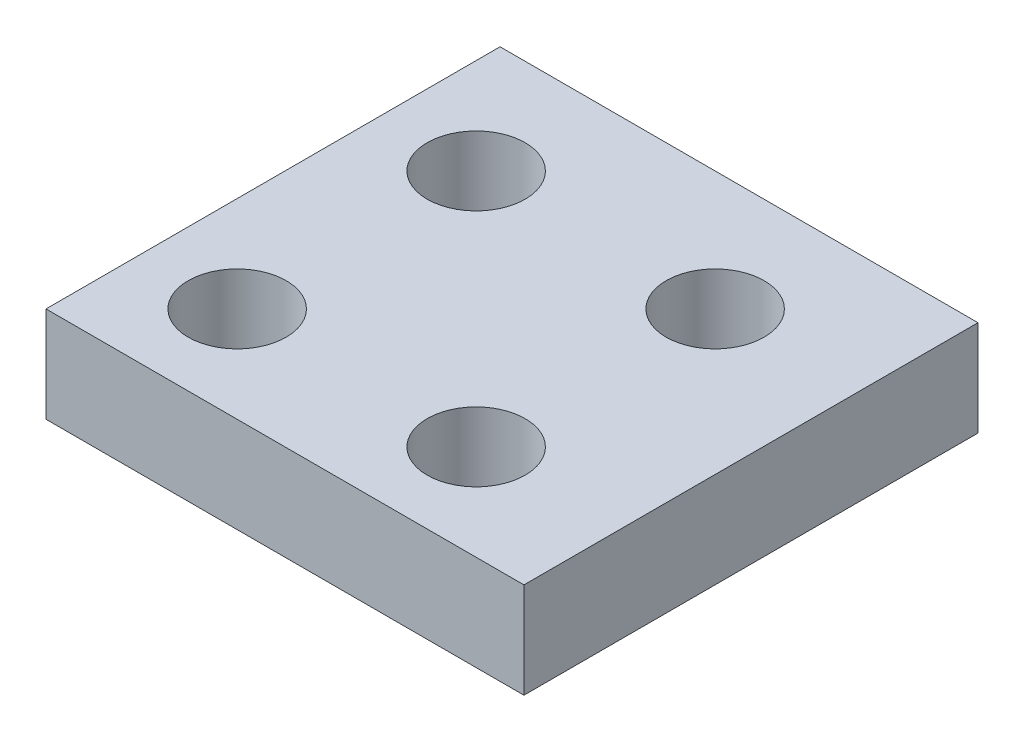
from build123d import *

# Parameters (mm, degrees)
SKETCH2_W               = 350
SKETCH2_H               = 350
BOSS_EXTRUDE2_DEPTH     = 10
ADVANCEDHOLE1_OUTLINE_R = 5.125
ADVANCEDHOLE1_DEPTH     = 10
CUT_EXTRUDE4_DEPTH      = 50
CUT_EXTRUDE5_DEPTH      = 50


# Read off the part's stored shape, not the designer's step: AdvancedHole1
with BuildPart() as part:
    # Sketch2 → Boss-Extrude2 (new body)
    with BuildSketch(Plane(origin=(0, 0, 0), x_dir=(1, 0, 0), z_dir=(0, 1, 0))):
        with Locations((175, 175)):
            Rectangle(SKETCH2_W, SKETCH2_H)
    extrude(amount=BOSS_EXTRUDE2_DEPTH)

    # AdvancedHole1 outline → AdvancedHole1 (cut)
    with BuildSketch(Plane(origin=(0, 0, 0), x_dir=(1, 0, 0), z_dir=(0, 1, 0))):
        with Locations((10, 310)):
            Circle(ADVANCEDHOLE1_OUTLINE_R)
        with Locations((10, 335)):
            Circle(ADVANCEDHOLE1_OUTLINE_R)
        with Locations((35, 335)):
            Circle(ADVANCEDHOLE1_OUTLINE_R)
        with Locations((35, 310)):
            Circle(ADVANCEDHOLE1_OUTLINE_R)
        with Locations((60, 335)):
            Circle(ADVANCEDHOLE1_OUTLINE_R)
        with Locations((85, 335)):
            Circle(ADVANCEDHOLE1_OUTLINE_R)
        with Locations((60, 310)):
            Circle(ADVANCEDHOLE1_OUTLINE_R)
        with Locations((85, 310)):
            Circle(ADVANCEDHOLE1_OUTLINE_R)
        with Locations((10, 285)):
            Circle(ADVANCEDHOLE1_OUTLINE_R)
        with Locations((35, 285)):
            Circle(ADVANCEDHOLE1_OUTLINE_R)
        with Locations((60, 285)):
            Circle(ADVANCEDHOLE1_OUTLINE_R)
        with Locations((85, 285)):
            Circle(ADVANCEDHOLE1_OUTLINE_R)
        with Locations((10, 260)):
            Circle(ADVANCEDHOLE1_OUTLINE_R)
        with Locations((35, 260)):
            Circle(ADVANCEDHOLE1_OUTLINE_R)
        with Locations((60, 260)):
            Circle(ADVANCEDHOLE1_OUTLINE_R)
        with Locations((85, 260)):
            Circle(ADVANCEDHOLE1_OUTLINE_R)
        with Locations((110, 285)):
            Circle(ADVANCEDHOLE1_OUTLINE_R)
        with Locations((110, 310)):
            Circle(ADVANCEDHOLE1_OUTLINE_R)
        with Locations((110, 335)):
            Circle(ADVANCEDHOLE1_OUTLINE_R)
        with Locations((135, 285)):
            Circle(ADVANCEDHOLE1_OUTLINE_R)
        with Locations((135, 310)):
            Circle(ADVANCEDHOLE1_OUTLINE_R)
        with Locations((135, 335)):
            Circle(ADVANCEDHOLE1_OUTLINE_R)
        with Locations((160, 335)):
            Circle(ADVANCEDHOLE1_OUTLINE_R)
        with Locations((160, 310)):
            Circle(ADVANCEDHOLE1_OUTLINE_R)
        with Locations((110, 260)):
            Circle(ADVANCEDHOLE1_OUTLINE_R)
        with Locations((135, 260)):
            Circle(ADVANCEDHOLE1_OUTLINE_R)
        with Locations((160, 285)):
            Circle(ADVANCEDHOLE1_OUTLINE_R)
        with Locations((160, 260)):
            Circle(ADVANCEDHOLE1_OUTLINE_R)
        with Locations((185, 335)):
            Circle(ADVANCEDHOLE1_OUTLINE_R)
        with Locations((185, 310)):
            Circle(ADVANCEDHOLE1_OUTLINE_R)
        with Locations((185, 285)):
            Circle(ADVANCEDHOLE1_OUTLINE_R)
        with Locations((185, 260)):
            Circle(ADVANCEDHOLE1_OUTLINE_R)
        with Locations((210, 310)):
            Circle(ADVANCEDHOLE1_OUTLINE_R)
        with Locations((210, 335)):
            Circle(ADVANCEDHOLE1_OUTLINE_R)
        with Locations((235, 310)):
            Circle(ADVANCEDHOLE1_OUTLINE_R)
        with Locations((235, 335)):
            Circle(ADVANCEDHOLE1_OUTLINE_R)
        with Locations((260, 310)):
            Circle(ADVANCEDHOLE1_OUTLINE_R)
        with Locations((285, 310)):
            Circle(ADVANCEDHOLE1_OUTLINE_R)
        with Locations((260, 335)):
            Circle(ADVANCEDHOLE1_OUTLINE_R)
        with Locations((285, 335)):
            Circle(ADVANCEDHOLE1_OUTLINE_R)
        with Locations((310, 335)):
            Circle(ADVANCEDHOLE1_OUTLINE_R)
        with Locations((335, 335)):
            Circle(ADVANCEDHOLE1_OUTLINE_R)
        with Locations((310, 310)):
            Circle(ADVANCEDHOLE1_OUTLINE_R)
        with Locations((335, 310)):
            Circle(ADVANCEDHOLE1_OUTLINE_R)
        with Locations((210, 285)):
            Circle(ADVANCEDHOLE1_OUTLINE_R)
        with Locations((235, 285)):
            Circle(ADVANCEDHOLE1_OUTLINE_R)
        with Locations((260, 285)):
            Circle(ADVANCEDHOLE1_OUTLINE_R)
        with Locations((285, 285)):
            Circle(ADVANCEDHOLE1_OUTLINE_R)
        with Locations((310, 285)):
            Circle(ADVANCEDHOLE1_OUTLINE_R)
        with Locations((335, 285)):
            Circle(ADVANCEDHOLE1_OUTLINE_R)
        with Locations((210, 260)):
            Circle(ADVANCEDHOLE1_OUTLINE_R)
        with Locations((235, 260)):
            Circle(ADVANCEDHOLE1_OUTLINE_R)
        with Locations((260, 260)):
            Circle(ADVANCEDHOLE1_OUTLINE_R)
        with Locations((285, 260)):
            Circle(ADVANCEDHOLE1_OUTLINE_R)
        with Locations((310, 260)):
            Circle(ADVANCEDHOLE1_OUTLINE_R)
        with Locations((335, 260)):
            Circle(ADVANCEDHOLE1_OUTLINE_R)
        with Locations((10, 235)):
            Circle(ADVANCEDHOLE1_OUTLINE_R)
        with Locations((35, 235)):
            Circle(ADVANCEDHOLE1_OUTLINE_R)
        with Locations((60, 235)):
            Circle(ADVANCEDHOLE1_OUTLINE_R)
        with Locations((85, 235)):
            Circle(ADVANCEDHOLE1_OUTLINE_R)
        with Locations((110, 235)):
            Circle(ADVANCEDHOLE1_OUTLINE_R)
        with Locations((135, 235)):
            Circle(ADVANCEDHOLE1_OUTLINE_R)
        with Locations((160, 235)):
            Circle(ADVANCEDHOLE1_OUTLINE_R)
        with Locations((185, 235)):
            Circle(ADVANCEDHOLE1_OUTLINE_R)
        with Locations((210, 235)):
            Circle(ADVANCEDHOLE1_OUTLINE_R)
        with Locations((235, 235)):
            Circle(ADVANCEDHOLE1_OUTLINE_R)
        with Locations((260, 235)):
            Circle(ADVANCEDHOLE1_OUTLINE_R)
        with Locations((285, 235)):
            Circle(ADVANCEDHOLE1_OUTLINE_R)
        with Locations((310, 235)):
            Circle(ADVANCEDHOLE1_OUTLINE_R)
        with Locations((335, 235)):
            Circle(ADVANCEDHOLE1_OUTLINE_R)
        with Locations((10, 210)):
            Circle(ADVANCEDHOLE1_OUTLINE_R)
        with Locations((35, 210)):
            Circle(ADVANCEDHOLE1_OUTLINE_R)
        with Locations((60, 210)):
            Circle(ADVANCEDHOLE1_OUTLINE_R)
        with Locations((85, 210)):
            Circle(ADVANCEDHOLE1_OUTLINE_R)
        with Locations((110, 210)):
            Circle(ADVANCEDHOLE1_OUTLINE_R)
        with Locations((135, 210)):
            Circle(ADVANCEDHOLE1_OUTLINE_R)
        with Locations((160, 210)):
            Circle(ADVANCEDHOLE1_OUTLINE_R)
        with Locations((185, 210)):
            Circle(ADVANCEDHOLE1_OUTLINE_R)
        with Locations((210, 210)):
            Circle(ADVANCEDHOLE1_OUTLINE_R)
        with Locations((235, 210)):
            Circle(ADVANCEDHOLE1_OUTLINE_R)
        with Locations((260, 210)):
            Circle(ADVANCEDHOLE1_OUTLINE_R)
        with Locations((285, 210)):
            Circle(ADVANCEDHOLE1_OUTLINE_R)
        with Locations((310, 210)):
            Circle(ADVANCEDHOLE1_OUTLINE_R)
        with Locations((335, 210)):
            Circle(ADVANCEDHOLE1_OUTLINE_R)
        with Locations((10, 185)):
            Circle(ADVANCEDHOLE1_OUTLINE_R)
        with Locations((35, 185)):
            Circle(ADVANCEDHOLE1_OUTLINE_R)
        with Locations((60, 185)):
            Circle(ADVANCEDHOLE1_OUTLINE_R)
        with Locations((85, 185)):
            Circle(ADVANCEDHOLE1_OUTLINE_R)
        with Locations((110, 185)):
            Circle(ADVANCEDHOLE1_OUTLINE_R)
        with Locations((135, 185)):
            Circle(ADVANCEDHOLE1_OUTLINE_R)
        with Locations((160, 185)):
            Circle(ADVANCEDHOLE1_OUTLINE_R)
        with Locations((185, 185)):
            Circle(ADVANCEDHOLE1_OUTLINE_R)
        with Locations((210, 185)):
            Circle(ADVANCEDHOLE1_OUTLINE_R)
        with Locations((235, 185)):
            Circle(ADVANCEDHOLE1_OUTLINE_R)
        with Locations((260, 185)):
            Circle(ADVANCEDHOLE1_OUTLINE_R)
        with Locations((285, 185)):
            Circle(ADVANCEDHOLE1_OUTLINE_R)
        with Locations((310, 185)):
            Circle(ADVANCEDHOLE1_OUTLINE_R)
        with Locations((335, 185)):
            Circle(ADVANCEDHOLE1_OUTLINE_R)
        with Locations((10, 160)):
            Circle(ADVANCEDHOLE1_OUTLINE_R)
        with Locations((35, 160)):
            Circle(ADVANCEDHOLE1_OUTLINE_R)
        with Locations((60, 160)):
            Circle(ADVANCEDHOLE1_OUTLINE_R)
        with Locations((85, 160)):
            Circle(ADVANCEDHOLE1_OUTLINE_R)
        with Locations((110, 160)):
            Circle(ADVANCEDHOLE1_OUTLINE_R)
        with Locations((135, 160)):
            Circle(ADVANCEDHOLE1_OUTLINE_R)
        with Locations((160, 160)):
            Circle(ADVANCEDHOLE1_OUTLINE_R)
        with Locations((185, 160)):
            Circle(ADVANCEDHOLE1_OUTLINE_R)
        with Locations((210, 160)):
            Circle(ADVANCEDHOLE1_OUTLINE_R)
        with Locations((235, 160)):
            Circle(ADVANCEDHOLE1_OUTLINE_R)
        with Locations((260, 160)):
            Circle(ADVANCEDHOLE1_OUTLINE_R)
        with Locations((285, 160)):
            Circle(ADVANCEDHOLE1_OUTLINE_R)
        with Locations((310, 160)):
            Circle(ADVANCEDHOLE1_OUTLINE_R)
        with Locations((335, 160)):
            Circle(ADVANCEDHOLE1_OUTLINE_R)
        with Locations((10, 135)):
            Circle(ADVANCEDHOLE1_OUTLINE_R)
        with Locations((35, 135)):
            Circle(ADVANCEDHOLE1_OUTLINE_R)
        with Locations((60, 135)):
            Circle(ADVANCEDHOLE1_OUTLINE_R)
        with Locations((85, 135)):
            Circle(ADVANCEDHOLE1_OUTLINE_R)
        with Locations((110, 135)):
            Circle(ADVANCEDHOLE1_OUTLINE_R)
        with Locations((135, 135)):
            Circle(ADVANCEDHOLE1_OUTLINE_R)
        with Locations((160, 135)):
            Circle(ADVANCEDHOLE1_OUTLINE_R)
        with Locations((185, 135)):
            Circle(ADVANCEDHOLE1_OUTLINE_R)
        with Locations((210, 135)):
            Circle(ADVANCEDHOLE1_OUTLINE_R)
        with Locations((235, 135)):
            Circle(ADVANCEDHOLE1_OUTLINE_R)
        with Locations((260, 135)):
            Circle(ADVANCEDHOLE1_OUTLINE_R)
        with Locations((285, 135)):
            Circle(ADVANCEDHOLE1_OUTLINE_R)
        with Locations((310, 135)):
            Circle(ADVANCEDHOLE1_OUTLINE_R)
        with Locations((335, 135)):
            Circle(ADVANCEDHOLE1_OUTLINE_R)
        with Locations((10, 110)):
            Circle(ADVANCEDHOLE1_OUTLINE_R)
        with Locations((35, 110)):
            Circle(ADVANCEDHOLE1_OUTLINE_R)
        with Locations((60, 110)):
            Circle(ADVANCEDHOLE1_OUTLINE_R)
        with Locations((85, 110)):
            Circle(ADVANCEDHOLE1_OUTLINE_R)
        with Locations((110, 110)):
            Circle(ADVANCEDHOLE1_OUTLINE_R)
        with Locations((135, 110)):
            Circle(ADVANCEDHOLE1_OUTLINE_R)
        with Locations((160, 110)):
            Circle(ADVANCEDHOLE1_OUTLINE_R)
        with Locations((185, 110)):
            Circle(ADVANCEDHOLE1_OUTLINE_R)
        with Locations((210, 110)):
            Circle(ADVANCEDHOLE1_OUTLINE_R)
        with Locations((235, 110)):
            Circle(ADVANCEDHOLE1_OUTLINE_R)
        with Locations((260, 110)):
            Circle(ADVANCEDHOLE1_OUTLINE_R)
        with Locations((285, 110)):
            Circle(ADVANCEDHOLE1_OUTLINE_R)
        with Locations((310, 110)):
            Circle(ADVANCEDHOLE1_OUTLINE_R)
        with Locations((335, 110)):
            Circle(ADVANCEDHOLE1_OUTLINE_R)
        with Locations((10, 85)):
            Circle(ADVANCEDHOLE1_OUTLINE_R)
        with Locations((35, 85)):
            Circle(ADVANCEDHOLE1_OUTLINE_R)
        with Locations((60, 85)):
            Circle(ADVANCEDHOLE1_OUTLINE_R)
        with Locations((85, 85)):
            Circle(ADVANCEDHOLE1_OUTLINE_R)
        with Locations((110, 85)):
            Circle(ADVANCEDHOLE1_OUTLINE_R)
        with Locations((135, 85)):
            Circle(ADVANCEDHOLE1_OUTLINE_R)
        with Locations((160, 85)):
            Circle(ADVANCEDHOLE1_OUTLINE_R)
        with Locations((185, 85)):
            Circle(ADVANCEDHOLE1_OUTLINE_R)
        with Locations((210, 85)):
            Circle(ADVANCEDHOLE1_OUTLINE_R)
        with Locations((235, 85)):
            Circle(ADVANCEDHOLE1_OUTLINE_R)
        with Locations((260, 85)):
            Circle(ADVANCEDHOLE1_OUTLINE_R)
        with Locations((285, 85)):
            Circle(ADVANCEDHOLE1_OUTLINE_R)
        with Locations((310, 85)):
            Circle(ADVANCEDHOLE1_OUTLINE_R)
        with Locations((335, 85)):
            Circle(ADVANCEDHOLE1_OUTLINE_R)
        with Locations((335, 60)):
            Circle(ADVANCEDHOLE1_OUTLINE_R)
        with Locations((310, 60)):
            Circle(ADVANCEDHOLE1_OUTLINE_R)
        with Locations((285, 60)):
            Circle(ADVANCEDHOLE1_OUTLINE_R)
        with Locations((260, 60)):
            Circle(ADVANCEDHOLE1_OUTLINE_R)
        with Locations((235, 60)):
            Circle(ADVANCEDHOLE1_OUTLINE_R)
        with Locations((210, 60)):
            Circle(ADVANCEDHOLE1_OUTLINE_R)
        with Locations((185, 60)):
            Circle(ADVANCEDHOLE1_OUTLINE_R)
        with Locations((160, 60)):
            Circle(ADVANCEDHOLE1_OUTLINE_R)
        with Locations((135, 60)):
            Circle(ADVANCEDHOLE1_OUTLINE_R)
        with Locations((110, 60)):
            Circle(ADVANCEDHOLE1_OUTLINE_R)
        with Locations((85, 60)):
            Circle(ADVANCEDHOLE1_OUTLINE_R)
        with Locations((60, 60)):
            Circle(ADVANCEDHOLE1_OUTLINE_R)
        with Locations((35, 60)):
            Circle(ADVANCEDHOLE1_OUTLINE_R)
        with Locations((10, 60)):
            Circle(ADVANCEDHOLE1_OUTLINE_R)
        with Locations((10, 35)):
            Circle(ADVANCEDHOLE1_OUTLINE_R)
        with Locations((35, 35)):
            Circle(ADVANCEDHOLE1_OUTLINE_R)
        with Locations((60, 35)):
            Circle(ADVANCEDHOLE1_OUTLINE_R)
        with Locations((85, 35)):
            Circle(ADVANCEDHOLE1_OUTLINE_R)
        with Locations((110, 35)):
            Circle(ADVANCEDHOLE1_OUTLINE_R)
        with Locations((135, 35)):
            Circle(ADVANCEDHOLE1_OUTLINE_R)
        with Locations((160, 35)):
            Circle(ADVANCEDHOLE1_OUTLINE_R)
        with Locations((185, 35)):
            Circle(ADVANCEDHOLE1_OUTLINE_R)
        with Locations((210, 35)):
            Circle(ADVANCEDHOLE1_OUTLINE_R)
        with Locations((235, 35)):
            Circle(ADVANCEDHOLE1_OUTLINE_R)
        with Locations((260, 35)):
            Circle(ADVANCEDHOLE1_OUTLINE_R)
        with Locations((285, 35)):
            Circle(ADVANCEDHOLE1_OUTLINE_R)
        with Locations((310, 35)):
            Circle(ADVANCEDHOLE1_OUTLINE_R)
        with Locations((335, 35)):
            Circle(ADVANCEDHOLE1_OUTLINE_R)
        with Locations((10, 10)):
            Circle(ADVANCEDHOLE1_OUTLINE_R)
        with Locations((35, 10)):
            Circle(ADVANCEDHOLE1_OUTLINE_R)
        with Locations((60, 10)):
            Circle(ADVANCEDHOLE1_OUTLINE_R)
        with Locations((85, 10)):
            Circle(ADVANCEDHOLE1_OUTLINE_R)
        with Locations((110, 10)):
            Circle(ADVANCEDHOLE1_OUTLINE_R)
        with Locations((135, 10)):
            Circle(ADVANCEDHOLE1_OUTLINE_R)
        with Locations((160, 10)):
            Circle(ADVANCEDHOLE1_OUTLINE_R)
        with Locations((185, 10)):
            Circle(ADVANCEDHOLE1_OUTLINE_R)
        with Locations((210, 10)):
            Circle(ADVANCEDHOLE1_OUTLINE_R)
        with Locations((235, 10)):
            Circle(ADVANCEDHOLE1_OUTLINE_R)
        with Locations((260, 10)):
            Circle(ADVANCEDHOLE1_OUTLINE_R)
        with Locations((285, 10)):
            Circle(ADVANCEDHOLE1_OUTLINE_R)
        with Locations((310, 10)):
            Circle(ADVANCEDHOLE1_OUTLINE_R)
        with Locations((335, 10)):
            Circle(ADVANCEDHOLE1_OUTLINE_R)
    extrude(amount=ADVANCEDHOLE1_DEPTH, mode=Mode.SUBTRACT)

    # 3DSketch14 → Cut-Extrude4 (cut)
    with BuildSketch(Plane(origin=(350, 30, -47.5), x_dir=(-0.7565799289349062, 0, -0.6539012242937402), z_dir=(0, 1, 0))):
        Polygon((0, 0), (264.802975127, 228.865428503), (462.608095476, 0), (197.805120349, -228.865428503), align=None)
    extrude(amount=-CUT_EXTRUDE4_DEPTH, mode=Mode.SUBTRACT)

    # 3DSketch15 → Cut-Extrude5 (cut)
    with BuildSketch(Plane(origin=(300, 50, 0), x_dir=(-0.9876961386749972, 1.8714675105968527e-13, -0.15638522195687465), z_dir=(0, -1, 0))):
        Polygon((0, 0), (296.308841602, -46.915566587), (303.737139645, 0), (7.428298043, 46.915566587), align=None)
    extrude(amount=CUT_EXTRUDE5_DEPTH, mode=Mode.SUBTRACT)


solid = part.part
